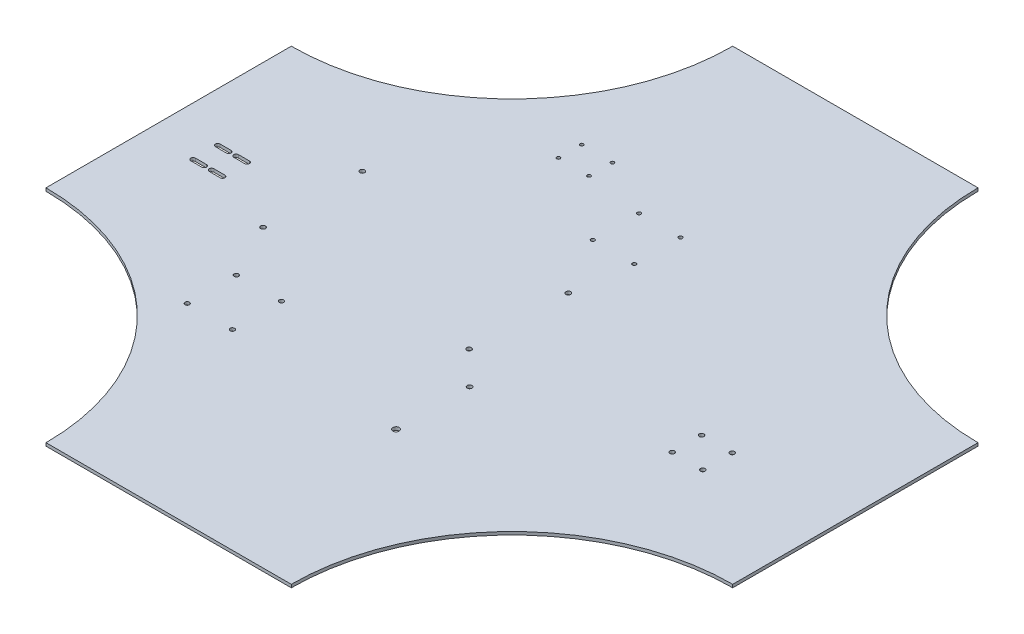
from build123d import *

# Parameters (mm, degrees)
BOSS_EXTRUDE1_DEPTH     = 3.175
CUT_EXTRUDE1_DEPTH      = 503.904365287
CUT_EXTRUDE1_DEPTH_BACK = 503.904365287
SKETCH4_R               = 2.413
CUT_EXTRUDE2_DEPTH      = 503.904365287
SKETCH5_R               = 2.5
SKETCH5_R_2             = 2.47796547
CUT_EXTRUDE3_DEPTH      = 503.904365287
SKETCH6_R               = 2.321781934
SKETCH6_R_2             = 3.272341149
SKETCH6_R_3             = 2.5
SKETCH6_R_4             = 1.905
SKETCH6_R_5             = 1.75
CUT_EXTRUDE4_DEPTH      = 503.904365287


with BuildPart() as part:
    # Sketch1 → Boss-Extrude1 (new body)
    with BuildSketch(Plane(origin=(0, 0, 0), x_dir=(1, 0, 0), z_dir=(0, 1, 0))):
        with BuildLine():
            Line((-127, -355.6), (127, -355.6))
            ThreePointArc((127, -355.6), (193.955389821, -193.955389821), (355.6, -127))
            Line((355.6, -127), (355.6, 127))
            ThreePointArc((355.6, 127), (193.955389821, 193.955389821), (127, 355.6))
            Line((127, 355.6), (-127, 355.6))
            ThreePointArc((-127, 355.6), (-193.955389821, 193.955389821), (-355.6, 127))
            Line((-355.6, 127), (-355.6, -127))
            ThreePointArc((-355.6, -127), (-193.955389821, -193.955389821), (-127, -355.6))
        make_face()
    extrude(amount=BOSS_EXTRUDE1_DEPTH)

    # Sketch2 → Cut-Extrude1 (cut, two sides: drawn at the far end of the back side and taken through both)
    with BuildSketch(Plane(origin=(0, 3.175, 0), x_dir=(1, 0, 0), z_dir=(0, 1, 0)).offset(-CUT_EXTRUDE1_DEPTH_BACK)):
        with BuildLine():
            Line((-304.8, 2.413), (-293.37, 2.413))
            ThreePointArc((-293.37, 2.413), (-290.957, 0), (-293.37, -2.413))
            Line((-293.37, -2.413), (-304.8, -2.413))
            ThreePointArc((-304.8, -2.413), (-307.213, 0), (-304.8, 2.413))
        make_face()
        with BuildLine():
            Line((-304.8, -22.987), (-293.37, -22.987))
            ThreePointArc((-293.37, -22.987), (-290.957, -25.4), (-293.37, -27.813))
            Line((-293.37, -27.813), (-304.8, -27.813))
            ThreePointArc((-304.8, -27.813), (-307.213, -25.4), (-304.8, -22.987))
        make_face()
        with BuildLine():
            Line((-285.75, -2.413), (-274.32, -2.413))
            ThreePointArc((-274.32, -2.413), (-271.907, 0), (-274.32, 2.413))
            Line((-274.32, 2.413), (-285.75, 2.413))
            ThreePointArc((-285.75, 2.413), (-288.163, 0), (-285.75, -2.413))
        make_face()
        with BuildLine():
            Line((-285.75, -22.987), (-274.32, -22.987))
            ThreePointArc((-274.32, -22.987), (-271.907, -25.4), (-274.32, -27.813))
            Line((-274.32, -27.813), (-285.75, -27.813))
            ThreePointArc((-285.75, -27.813), (-288.163, -25.4), (-285.75, -22.987))
        make_face()
    extrude(amount=CUT_EXTRUDE1_DEPTH + CUT_EXTRUDE1_DEPTH_BACK, mode=Mode.SUBTRACT)

    # Sketch4 → Cut-Extrude2 (cut, through all)
    with BuildSketch(Plane(origin=(0, 3.175, 0), x_dir=(1, 0, 0), z_dir=(0, 1, 0))):
        with Locations((237.49, -9.430177049)):
            Circle(SKETCH4_R)
        with Locations((205.74, -9.430177049)):
            Circle(SKETCH4_R)
        with Locations((237.49, -39.910177049)):
            Circle(SKETCH4_R)
        with Locations((205.74, -39.910177049)):
            Circle(SKETCH4_R)
    extrude(amount=-CUT_EXTRUDE2_DEPTH, mode=Mode.SUBTRACT)

    # Sketch5 → Cut-Extrude3 (cut, through all)
    with BuildSketch(Plane.XZ):
        with Locations((-207.790149601, 50.01656837)):
            Circle(SKETCH5_R)
        with Locations((-206.624048203, -51.576739518)):
            Circle(SKETCH5_R)
        with Locations((8.09562966, 52.494533839)):
            Circle(SKETCH5_R_2)
        with Locations((9.261731058, -49.098774048)):
            Circle(SKETCH5_R)
    extrude(amount=-CUT_EXTRUDE3_DEPTH, mode=Mode.SUBTRACT)

    # Sketch6 → Cut-Extrude4 (cut, through all)
    with BuildSketch(Plane.XZ):
        with Locations((-131.96570437, 157.594741445)):
            Circle(SKETCH6_R)
        with Locations((-131.96570437, 106.794741445)):
            Circle(SKETCH6_R)
        with Locations((-178.700591901, 106.794741445)):
            Circle(SKETCH6_R)
        with Locations((-178.700591901, 157.594741445)):
            Circle(SKETCH6_R)
        with Locations((42.265908941, 162.337536061)):
            Circle(SKETCH6_R_2)
        with Locations((42.265908941, 86.137536061)):
            Circle(SKETCH6_R_3)
        with Locations((17.371687145, -109.265722508)):
            Circle(SKETCH6_R_4)
        with Locations((-25.681149945, -109.384160374)):
            Circle(SKETCH6_R_4)
        with Locations((-25.549785233, -157.135979683)):
            Circle(SKETCH6_R_4)
        with Locations((17.503045383, -157.015188359)):
            Circle(SKETCH6_R_4)
        with Locations((-84.882409293, -188.871278488)):
            Circle(SKETCH6_R_5)
        with Locations((-85.091846145, -164.872192335)):
            Circle(SKETCH6_R_5)
        with Locations((-116.881190831, -189.150527624)):
            Circle(SKETCH6_R_5)
        with Locations((-117.090627683, -165.151441471)):
            Circle(SKETCH6_R_5)
    extrude(amount=-CUT_EXTRUDE4_DEPTH, mode=Mode.SUBTRACT)


solid = part.part
